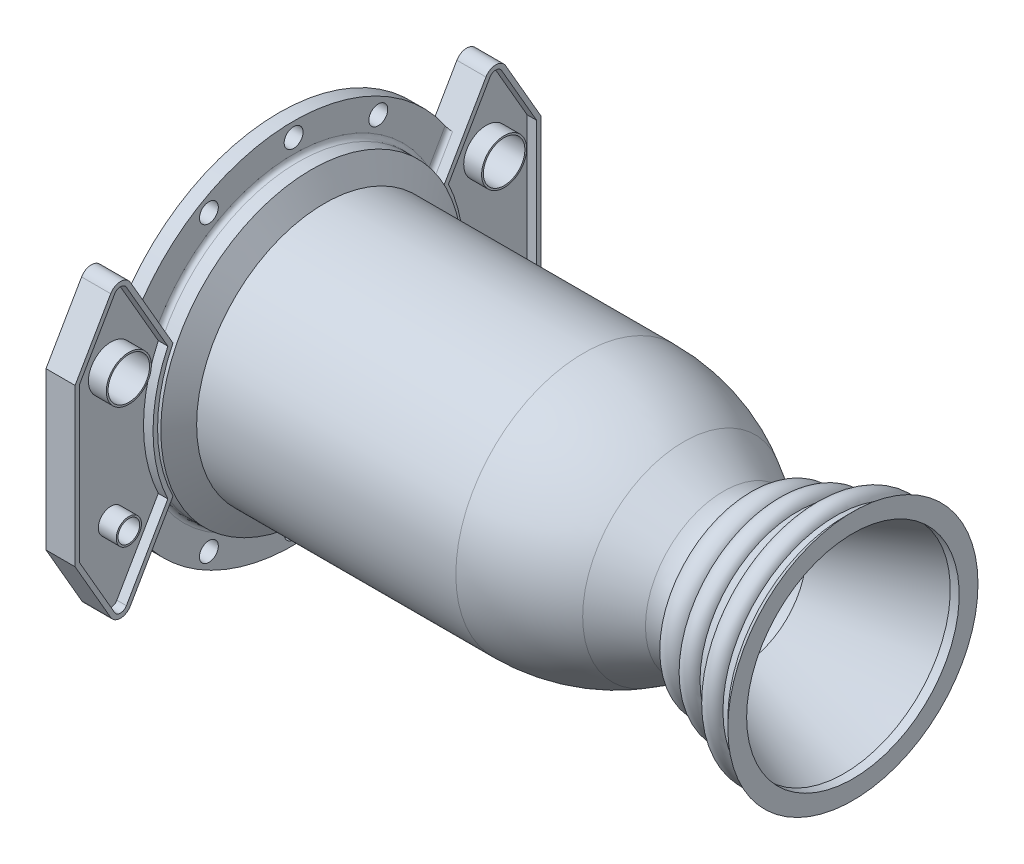
from build123d import *
from build123d.topology import SkipClean

# Parameters (mm, degrees)
BOSS_EXTRUDE1_DEPTH     = 16.256
CUT_EXTRUDE1_DEPTH      = 5.334
BOSS_EXTRUDE2_START     = -8.128
BOSS_EXTRUDE2_DEPTH     = 8.128
FILLET2_R               = 2.54
SKETCH9_R               = 5.275
CUT_EXTRUDE2_DEPTH      = 419.885269444
SKETCH10_R              = 11.6
SKETCH10_R_2            = 6.05
CUT_EXTRUDE3_DEPTH      = 417.321354466
BOSS_EXTRUDE3_START     = 10
SKETCH11_R              = 12.6
SKETCH11_R_2            = 11.6
SKETCH11_R_3            = 7.05
SKETCH11_R_4            = 6.05
BOSS_EXTRUDE3_DEPTH     = 10
CUT_EXTRUDE4_DEPTH      = 404.084600433
CUT_EXTRUDE4_DEPTH_BACK = 404.084600433
SKETCH17_W              = 85
SKETCH17_H              = 190


with BuildPart() as part:
    # Sketch3 → Revolve1 (revolve)
    with BuildSketch(Plane.XY):
        with BuildLine():
            Line((0, 71.5011717), (144.934666475, 71.5011717))
            ThreePointArc((144.934666475, 71.5011717), (173.892574508, 67.688769671), (200.877042723, 56.51141211))
            Line((200.877042723, 56.51141211), (223.127154881, 43.665279514))
            ThreePointArc((223.127154881, 43.665279514), (227.625034583, 41.721337074), (232.448772375, 40.860298318))
            add(Edge.make_bspline(
                [(232.448772375, 40.860298318), (234.86856203, 41.933657894), (240.173238318, 44.266655644), (251.176182965, 49.013937562), (265.440009786, 54.97345202), (282.448229164, 61.765962568), (299.354503113, 68.202057856), (316.156963457, 74.280596731), (332.857651733, 80.001884245), (346.685594207, 84.470267584), (357.704525634, 87.868146407), (363.182392167, 89.503083437), (365.9308663, 90.309661005)],
                knots=[0.492875979, 0.492875979, 0.492875979, 0.492875979, 0.492966882, 0.493074775, 0.493290561, 0.493506346, 0.493722132, 0.493937918, 0.494153704, 0.494369489, 0.494477382, 0.494585275, 0.494585275, 0.494585275, 0.494585275], degree=3))
            Line((365.9308663, 90.309661005), (367.338810321, 85.511985147))
            add(Edge.make_bspline(
                [(233.424633311, 35.822756061), (236.183141196, 37.049408729), (241.820242455, 39.531718175), (253.12775411, 44.410404122), (267.331680592, 50.344882311), (284.265598042, 57.10770533), (301.095145103, 63.51457761), (317.818383555, 69.564442688), (334.43732724, 75.257710839), (348.19495997, 79.703362784), (359.156425704, 83.083517043), (364.604957844, 84.709698506), (367.338810321, 85.511985147)],
                knots=[0.492862754, 0.492862754, 0.492862754, 0.492862754, 0.492966882, 0.493074775, 0.493290561, 0.493506346, 0.493722132, 0.493937918, 0.494153704, 0.494369489, 0.494477382, 0.494585275, 0.494585275, 0.494585275, 0.494585275], degree=3))
            ThreePointArc((233.424633311, 35.822756061), (226.800103593, 36.756276843), (220.627157517, 39.335150973))
            Line((220.627157517, 39.335150973), (198.377039169, 52.181287144))
            ThreePointArc((198.377039169, 52.181287144), (172.598474463, 62.859141831), (144.9346606, 66.5011717))
            Line((144.9346606, 66.5011717), (0, 66.5011717))
            Line((0, 66.5011717), (0, 71.5011717))
        make_face()
    revolve(axis=Axis((0, 0, 0), (1, 0, 0)))

    # Sketch4 → Revolve5 (revolve)
    with BuildSketch(Plane.XY):
        Polygon((-25.4, 66.5011717), (-25.4, 84.2011717), (-7.332348419, 84.2011717), (0, 71.5011717), (0, 66.5011717), align=None)
    revolve(axis=Axis((0, 0, 0), (1, 0, 0)))

    # Sketch6 → Boss-Extrude1 (add)
    with SkipClean():  # the faces are left unmerged after this step: merging them gives an invalid solid
        with BuildSketch(Plane.ZY.offset(25.4)):
            with BuildLine():
                Line((64.197098299, 17.35333995), (99.428641487, 78.37616278))
                ThreePointArc((99.428641487, 78.37616278), (104.927902801, 81.55116278), (110.427164115, 78.37616278))
                Line((110.427164115, 78.37616278), (130.327902801, 43.907072268))
                Line((130.327902801, 43.907072268), (130.327902801, -43.907072268))
                Line((130.327902801, -43.907072268), (110.427164115, -78.37616278))
                ThreePointArc((110.427164115, -78.37616278), (104.927902801, -81.55116278), (99.428641487, -78.37616278))
                Line((99.428641487, -78.37616278), (64.197098299, -17.35333995))
                ThreePointArc((64.197098299, -17.35333995), (66.5011717, 0), (64.197098299, 17.35333995))
            make_face()
            with BuildLine():
                Line((-64.197098299, -17.35333995), (-99.428641487, -78.37616278))
                ThreePointArc((-99.428641487, -78.37616278), (-104.927902801, -81.55116278), (-110.427164115, -78.37616278))
                Line((-110.427164115, -78.37616278), (-130.327902801, -43.907072268))
                Line((-130.327902801, -43.907072268), (-130.327902801, 43.907072268))
                Line((-130.327902801, 43.907072268), (-110.427164115, 78.37616278))
                ThreePointArc((-110.427164115, 78.37616278), (-104.927902801, 81.55116278), (-99.428641487, 78.37616278))
                Line((-99.428641487, 78.37616278), (-64.197098299, 17.35333995))
                ThreePointArc((-64.197098299, 17.35333995), (-66.5011717, 0), (-64.197098299, -17.35333995))
            make_face()
        extrude(amount=-BOSS_EXTRUDE1_DEPTH)

    # Sketch7 → Cut-Extrude1 (cut)
    with SkipClean():  # the faces are left unmerged after this step: merging them gives an invalid solid
        with BuildSketch(Plane(origin=(-9.144, 0, 0), x_dir=(0, 0, -1), z_dir=(1, 0, 0))):
            with BuildLine():
                Line((-78.462562562, 36.981848846), (-101.628346013, 77.10616278))
                ThreePointArc((-101.628346013, 77.10616278), (-104.927902801, 79.01116278), (-108.22745959, 77.10616278))
                Line((-108.22745959, 77.10616278), (-127.787902801, 43.226481319))
                Line((-127.787902801, 43.226481319), (-127.787902801, -43.226481319))
                Line((-127.787902801, -43.226481319), (-108.22745959, -77.10616278))
                ThreePointArc((-108.22745959, -77.10616278), (-104.927902801, -79.01116278), (-101.628346013, -77.10616278))
                Line((-101.628346013, -77.10616278), (-78.462562562, -36.981848846))
                ThreePointArc((-78.462562562, -36.981848846), (-86.7411717, 0), (-78.462562562, 36.981848846))
            make_face()
            with BuildLine():
                Line((101.628346013, -77.10616278), (78.462562562, -36.981848846))
                ThreePointArc((78.462562562, -36.981848846), (86.7411717, 0), (78.462562562, 36.981848846))
                Line((78.462562562, 36.981848846), (101.628346013, 77.10616278))
                ThreePointArc((101.628346013, 77.10616278), (104.927902801, 79.01116278), (108.22745959, 77.10616278))
                Line((108.22745959, 77.10616278), (127.787902801, 43.226481319))
                Line((127.787902801, 43.226481319), (127.787902801, -43.226481319))
                Line((127.787902801, -43.226481319), (108.22745959, -77.10616278))
                ThreePointArc((108.22745959, -77.10616278), (104.927902801, -79.01116278), (101.628346013, -77.10616278))
            make_face()
        extrude(amount=-CUT_EXTRUDE1_DEPTH, mode=Mode.SUBTRACT)

    # Sketch8 → Boss-Extrude2 (add)
    with SkipClean():  # the faces are left unmerged after this step: merging them gives an invalid solid
        with BuildSketch(Plane.ZY.offset(25.4).offset(BOSS_EXTRUDE2_START)):
            with BuildLine():
                Line((-75.592096587, 37.090055935), (-86.329826389, 55.688349511))
                ThreePointArc((-86.329826389, 55.688349511), (0, 102.7328146), (86.329826389, 55.688349511))
                Line((86.329826389, 55.688349511), (75.592096587, 37.090055935))
                ThreePointArc((75.592096587, 37.090055935), (0, 84.2011717), (-75.592096587, 37.090055935))
            make_face()
            with BuildLine():
                Line((86.329826389, -55.688349511), (75.592096587, -37.090055935))
                ThreePointArc((75.592096587, -37.090055935), (0, -84.2011717), (-75.592096587, -37.090055935))
                Line((-75.592096587, -37.090055935), (-86.329826389, -55.688349511))
                ThreePointArc((-86.329826389, -55.688349511), (0, -102.7328146), (86.329826389, -55.688349511))
            make_face()
        extrude(amount=BOSS_EXTRUDE2_DEPTH)

    # Fillet2
    fillet2_edges = [part.edges().sort_by_distance(p)[0] for p in [
        (-17.272, 46.389202723, 80.960961488),
        (-17.272, 71.459301297, 44.535441771),
        (-17.272, 46.389202723, -80.960961488),
        (-17.272, -46.389202723, -80.960961488),
        (-17.272, -84.2011717, 0),
        (-17.272, -46.389202723, 80.960961488),
    ]]
    fillet(fillet2_edges, radius=FILLET2_R)

    # Sketch9 → Cut-Extrude2 (cut, through all)
    with SkipClean():  # the faces are left unmerged after this step: merging them gives an invalid solid
        with BuildSketch(Plane(origin=(-17.272, 0, 0), x_dir=(0, 0, -1), z_dir=(1, 0, 0))):
            with Locations((0, 94.73699315)):
                Circle(SKETCH9_R)
            with Locations((-47.368496575, 82.044642746)):
                Circle(SKETCH9_R)
            with Locations((47.368496575, 82.044642746)):
                Circle(SKETCH9_R)
            with Locations((47.368496575, -82.044642746)):
                Circle(SKETCH9_R)
            with Locations((0, -94.73699315)):
                Circle(SKETCH9_R)
            with Locations((-47.368496575, -82.044642746)):
                Circle(SKETCH9_R)
        extrude(amount=-CUT_EXTRUDE2_DEPTH, mode=Mode.SUBTRACT)

    # Sketch10 → Cut-Extrude3 (cut, through all)
    with SkipClean():  # the faces are left unmerged after this step: merging them gives an invalid solid
        with BuildSketch(Plane(origin=(-14.478, 0, 0), x_dir=(0, 0, -1), z_dir=(1, 0, 0))):
            with Locations((-104.927902801, 36.981848846)):
                Circle(SKETCH10_R)
            with Locations((-104.927902801, -36.981848846)):
                Circle(SKETCH10_R_2)
            with Locations((104.927902801, -36.981848846)):
                Circle(SKETCH10_R_2)
            with Locations((104.927902801, 36.981848846)):
                Circle(SKETCH10_R)
        extrude(amount=-CUT_EXTRUDE3_DEPTH, mode=Mode.SUBTRACT)

    # Sketch11 → Boss-Extrude3 (add)
    # profile 1 of 4: a face of its own
    with SkipClean():  # the faces are left unmerged after this step: merging them gives an invalid solid
        with BuildSketch(Plane(origin=(-14.478, 0, 0), x_dir=(0, 0, -1), z_dir=(1, 0, 0)).offset(BOSS_EXTRUDE3_START)):
            with Locations((-104.927902801, 36.981848846)):
                Circle(SKETCH11_R)
            with Locations((-104.927902801, 36.981848846)):
                Circle(SKETCH11_R_2, mode=Mode.SUBTRACT)
        # profile 2 of 4: a face of its own
        with BuildSketch(Plane(origin=(-14.478, 0, 0), x_dir=(0, 0, -1), z_dir=(1, 0, 0)).offset(BOSS_EXTRUDE3_START)):
            with Locations((-104.927902801, -36.981848846)):
                Circle(SKETCH11_R_3)
            with Locations((-104.927902801, -36.981848846)):
                Circle(SKETCH11_R_4, mode=Mode.SUBTRACT)
        # profile 3 of 4: a face of its own
        with BuildSketch(Plane(origin=(-14.478, 0, 0), x_dir=(0, 0, -1), z_dir=(1, 0, 0)).offset(BOSS_EXTRUDE3_START)):
            with Locations((104.927902801, -36.981848846)):
                Circle(SKETCH11_R_3)
            with Locations((104.927902801, -36.981848846)):
                Circle(SKETCH11_R_4, mode=Mode.SUBTRACT)
        # profile 4 of 4: a face of its own
        with BuildSketch(Plane(origin=(-14.478, 0, 0), x_dir=(0, 0, -1), z_dir=(1, 0, 0)).offset(BOSS_EXTRUDE3_START)):
            with Locations((104.927902801, 36.981848846)):
                Circle(SKETCH11_R)
            with Locations((104.927902801, 36.981848846)):
                Circle(SKETCH11_R_2, mode=Mode.SUBTRACT)
        extrude(amount=-BOSS_EXTRUDE3_DEPTH)

    # Sketch17 → Cut-Extrude4 (cut, two sides: drawn at the far end of the back side and taken through both)
    with SkipClean():  # the faces are left unmerged after this step: merging them gives an invalid solid
        with BuildSketch(Plane.XY.offset(-CUT_EXTRUDE4_DEPTH_BACK)):
            with Locations((332.986, 0)):
                Rectangle(SKETCH17_W, SKETCH17_H)
        extrude(amount=CUT_EXTRUDE4_DEPTH + CUT_EXTRUDE4_DEPTH_BACK, mode=Mode.SUBTRACT)

    # Sketch18 → Revolve7 (revolve)
    with SkipClean():  # the faces are left unmerged after this step: merging them gives an invalid solid
        with BuildSketch(Plane.XY):
            Polygon((290.486, 64.939439056), (295.486, 69.939439056), (295.486, 59.440561387), (290.486, 59.440561387), align=None)
        revolve(axis=Axis((0, 0, 0), (1, 0, 0)))

    # Sketch13 → Revolve6 (revolve)
    with SkipClean():  # the faces are left unmerged after this step: merging them gives an invalid solid
        with BuildSketch(Plane.XY):
            with BuildLine():
                Line((253.452894778, 49.926348503), (264.534326054, 54.53089852))
                ThreePointArc((264.534326054, 54.53089852), (256.691335407, 57.76933915), (253.452894778, 49.926348503))
            make_face()
            with BuildLine():
                Line((237.023320854, 42.878591235), (250.795528896, 48.822161344))
                ThreePointArc((250.795528896, 48.822161344), (240.940832573, 52.729082189), (237.023320854, 42.878591235))
            make_face()
            with BuildLine():
                Line((274.647447045, 58.637166289), (285.817898038, 63.021229116))
                ThreePointArc((285.817898038, 63.021229116), (278.034805802, 66.429291422), (274.647447045, 58.637166289))
            make_face()
        revolve(axis=Axis((0, 0, 0), (1, 0, 0)))


solid = part.part
